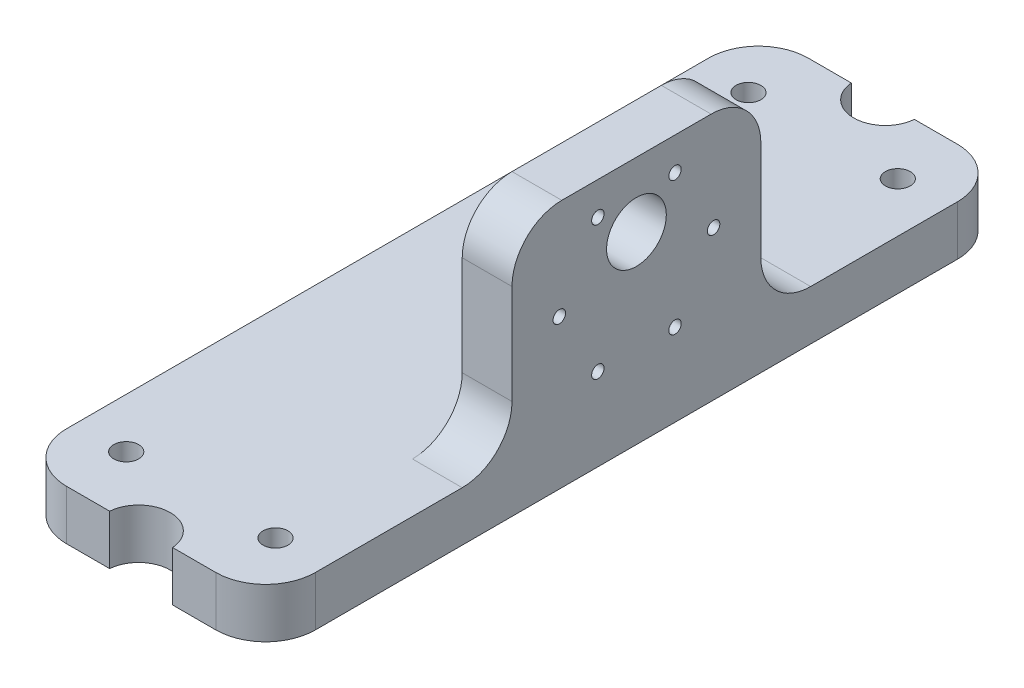
from build123d import *

# Parameters (mm, degrees)
SKETCH1_R           = 2.5
BOSS_EXTRUDE1_DEPTH = 10
SKETCH2_W           = 10
SKETCH2_H           = 50
BOSS_EXTRUDE2_DEPTH = 50
SKETCH3_R           = 1.25
SKETCH3_R_2         = 6
CUT_EXTRUDE1_DEPTH  = 25
FILLET1_R           = 10


with BuildPart() as part:
    # Sketch1 → Boss-Extrude1 (new body)
    with BuildSketch(Plane(origin=(0, 0, 0), x_dir=(1, 0, 0), z_dir=(0, 1, 0))):
        with BuildLine():
            Line((-25, 74.5), (-25, -74.5))
            Line((-25, -74.5), (-6.330284354, -74.5))
            ThreePointArc((-6.330284354, -74.5), (0, -68.65), (6.330284354, -74.5))
            Line((6.330284354, -74.5), (25, -74.5))
            Line((25, -74.5), (25, -17))
            Line((25, -17), (25, 17))
            Line((25, 17), (25, 74.5))
            Line((25, 74.5), (6.330284354, 74.5))
            ThreePointArc((6.330284354, 74.5), (0, 68.65), (-6.330284354, 74.5))
            Line((-6.330284354, 74.5), (-25, 74.5))
        make_face()
        with Locations((-15, -62.5)):
            Circle(SKETCH1_R, mode=Mode.SUBTRACT)
        with Locations((15, -62.5)):
            Circle(SKETCH1_R, mode=Mode.SUBTRACT)
        with Locations((-15, 62.5)):
            Circle(SKETCH1_R, mode=Mode.SUBTRACT)
        with Locations((15, 62.5)):
            Circle(SKETCH1_R, mode=Mode.SUBTRACT)
    extrude(amount=BOSS_EXTRUDE1_DEPTH)

    # Sketch2 → Boss-Extrude2 (add)
    with BuildSketch(Plane(origin=(0, 0, 0), x_dir=(1, 0, 0), z_dir=(0, 1, 0))):
        with Locations((20, 0)):
            Rectangle(SKETCH2_W, SKETCH2_H)
    extrude(amount=BOSS_EXTRUDE2_DEPTH)

    # Sketch3 → Cut-Extrude1 (cut)
    with BuildSketch(Plane(origin=(25, 0, 0), x_dir=(0, 0, -1), z_dir=(1, 0, 0))):
        with Locations((-15.5, 30)):
            Circle(SKETCH3_R)
        with Locations((0, 37)):
            Circle(SKETCH3_R_2)
        with Locations((-7.75, 43.423393759)):
            Circle(SKETCH3_R)
        with Locations((7.75, 43.423393759)):
            Circle(SKETCH3_R)
        with Locations((15.5, 30)):
            Circle(SKETCH3_R)
        with Locations((7.75, 16.576606241)):
            Circle(SKETCH3_R)
        with Locations((-7.75, 16.576606241)):
            Circle(SKETCH3_R)
    extrude(amount=-CUT_EXTRUDE1_DEPTH, mode=Mode.SUBTRACT)

    # Fillet1
    fillet1_edges = [part.edges().sort_by_distance(p)[0] for p in [
        (-25, 5, -74.5),
        (25, 5, -74.5),
        (-25, 5, 74.5),
        (25, 5, 74.5),
        (20, 10, -25),
        (20, 50, -25),
        (20, 50, 25),
        (20, 10, 25),
    ]]
    fillet(fillet1_edges, radius=FILLET1_R)


solid = part.part
